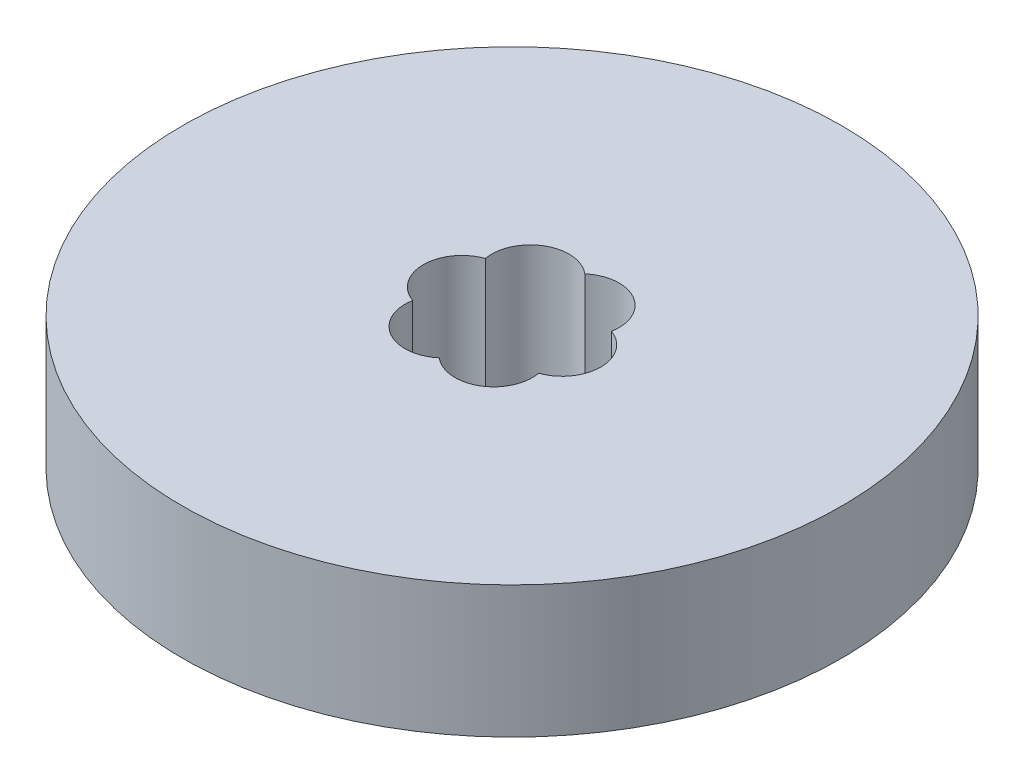
from build123d import *

# Parameters (mm, degrees)
SKETCH1_R           = 32.5
BOSS_EXTRUDE1_DEPTH = 13
SKETCH2_R           = 5
CUT_EXTRUDE1_DEPTH  = 48.765049984
SKETCH3_R           = 3.808073824
CUT_EXTRUDE2_DEPTH  = 12.847377104
CIRPATTERN1_COUNT   = 6


with BuildPart() as part:
    # Sketch1 → Boss-Extrude1 (new body)
    with BuildSketch(Plane(origin=(0, 0, 0), x_dir=(1, 0, 0), z_dir=(0, 1, 0))):
        Circle(SKETCH1_R)
    extrude(amount=BOSS_EXTRUDE1_DEPTH)

    # Sketch2 → Cut-Extrude1 (cut, through all)
    with BuildSketch(Plane(origin=(0, 0, 0), x_dir=(1, 0, 0), z_dir=(0, 1, 0))):
        Circle(SKETCH2_R)
    extrude(amount=CUT_EXTRUDE1_DEPTH, mode=Mode.SUBTRACT)

    # Sketch3 → Cut-Extrude2 (cut)
    with BuildSketch(Plane(origin=(0, 13, 0), x_dir=(1, 0, 0), z_dir=(0, 1, 0))):
        with Locations((-4.941482649, 0)):
            Circle(SKETCH3_R)
    cut_extrude2 = extrude(amount=-CUT_EXTRUDE2_DEPTH, mode=Mode.SUBTRACT)

    # CirPattern1: Cut-Extrude2 ×6 about axis
    cirpattern1_axis = Axis((0, 0, 0), (0, 1, 0))
    for i in range(1, CIRPATTERN1_COUNT):
        add(cut_extrude2.rotate(cirpattern1_axis, i * 360 / CIRPATTERN1_COUNT), mode=Mode.SUBTRACT)


solid = part.part
